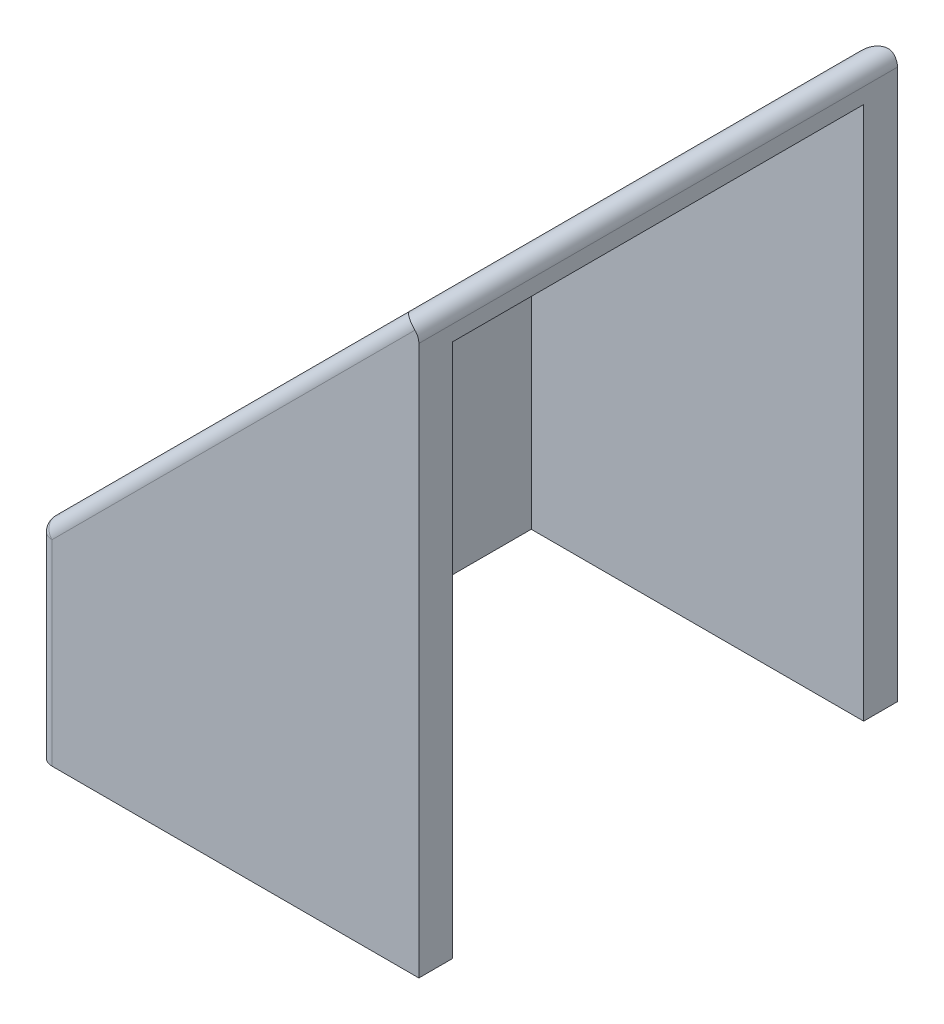
from build123d import *

# Parameters (mm, degrees)
BOSS_EXTRUDE1_DEPTH              = 22.606
CUT_EXTRUDE1_REACH               = 37.603
CUT_EXTRUDE1_OFFSET_FROM_SURFACE = 1.6
SKETCH2_W                        = 19.406
SKETCH2_H                        = 16.360512242
BOSS_EXTRUDE2_DEPTH              = 9.525
FILLET1_R                        = 0.635


with BuildPart() as part:
    # Sketch1 → Boss-Extrude1 (new body)
    with BuildSketch(Plane.XY):
        Polygon((0, 0), (17.960512242, 17.960512242), (17.960512242, 0), align=None)
    extrude(amount=BOSS_EXTRUDE1_DEPTH)

    # Cut-Extrude1: up to this face of the body (flat: up to its plane, moved by the offset)
    cut_extrude1_end = Plane(part.part.faces().sort_by_distance((8.980256121, 8.980256121, 11.303))[0]).offset(-CUT_EXTRUDE1_OFFSET_FROM_SURFACE)
    # Sketch2 → Cut-Extrude1 (cut, up to the picked face)
    with BuildSketch(Plane(origin=(17.960512242, 0, 0), x_dir=(0, 0, -1), z_dir=(1, 0, 0)), mode=Mode.PRIVATE) as cut_extrude1_sk1:
        with Locations((-11.303, 8.180256121)):
            Rectangle(SKETCH2_W, SKETCH2_H)
    cut_extrude1_tool1 = split(extrude(cut_extrude1_sk1.sketch, amount=-CUT_EXTRUDE1_REACH, mode=Mode.PRIVATE), bisect_by=cut_extrude1_end, keep=Keep.BOTH, mode=Mode.PRIVATE)
    add(cut_extrude1_tool1.solids().sort_by(Axis((17.960512, 8.180256, 11.303), (-1, 0, 0)))[0], mode=Mode.SUBTRACT)

    # Sketch3 → Boss-Extrude2 (add)
    with BuildSketch(Plane.XZ):
        Polygon((17.960512242, 22.606), (0, 22.606), (0, 0), (17.960512242, 0), (17.960512242, 1.6), (2.2627417, 1.6), (2.2627417, 21.006), (17.960512242, 21.006), align=None)
    extrude(amount=BOSS_EXTRUDE2_DEPTH)

    # Fillet1
    fillet1_edges = [part.edges().sort_by_distance(p)[0] for p in [
        (17.960512242, 17.960512242, 11.303),
        (0, 0, 11.303),
        (8.980256121, 8.980256121, 0),
        (8.980256121, 8.980256121, 22.606),
        (0, -4.7625, 0),
        (0, -4.7625, 22.606),
    ]]
    fillet(fillet1_edges, radius=FILLET1_R)


solid = part.part
